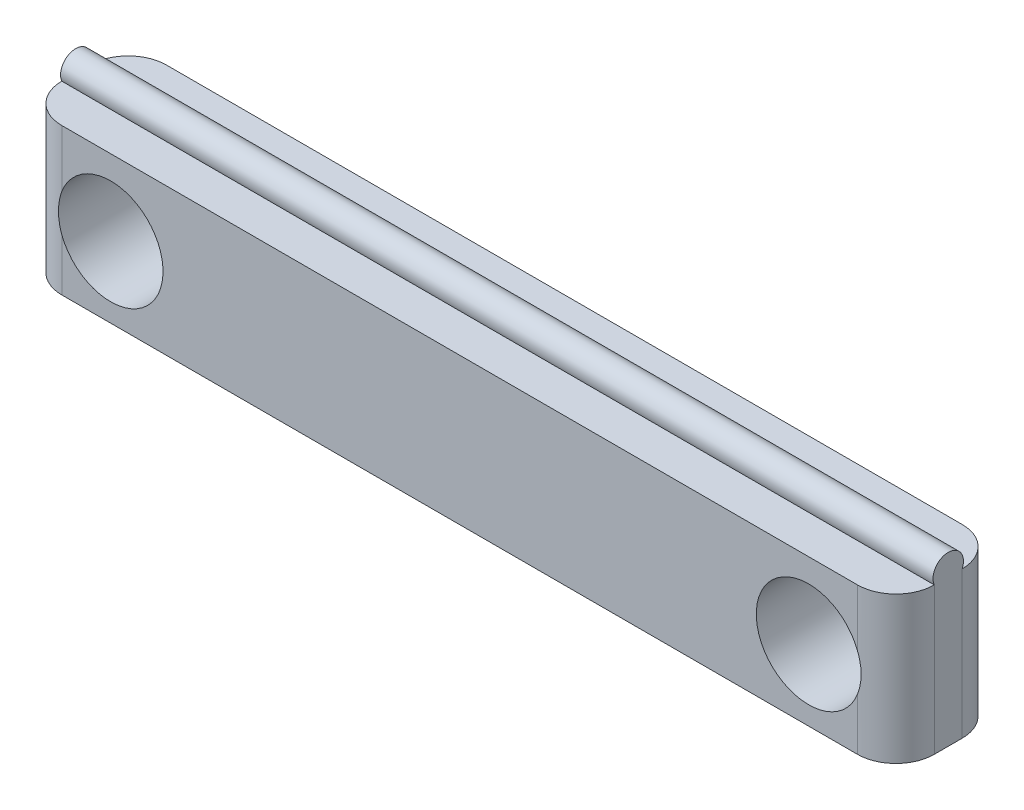
from build123d import *

# Parameters (mm, degrees)
SKETCH1_W           = 1250
SKETCH1_H           = 210.257392811
BOSS_EXTRUDE1_DEPTH = 150
SKETCH2_R           = 75
CUT_EXTRUDE1_DEPTH  = 150
FILLET3_R           = 55
BOSS_EXTRUDE2_DEPTH = 1250


with BuildPart() as part:
    # Sketch1 → Boss-Extrude1 (new body)
    with BuildSketch(Plane.XY):
        with Locations((500, 3.571821645)):
            Rectangle(SKETCH1_W, SKETCH1_H)
    extrude(amount=BOSS_EXTRUDE1_DEPTH)

    # Sketch2 → Cut-Extrude1 (cut)
    with BuildSketch(Plane.XY.offset(150)):
        Circle(SKETCH2_R)
        with Locations((1000, 0)):
            Circle(SKETCH2_R)
    extrude(amount=-CUT_EXTRUDE1_DEPTH, mode=Mode.SUBTRACT)

    # Fillet3
    # the kernel refuses this fillet: 55 mm, written as the material it takes off along each edge
    with BuildSketch(Plane(origin=(1125, 246.20051805, 150), x_dir=(0, 0, -1), z_dir=(0, -1, 0)), Plane(origin=(-125, -239.056874761, 150), x_dir=(0, 0, -1), z_dir=(0, 1, 0))) as fillet3_piece_1:
        with BuildLine():
            CenterArc((FILLET3_R, -FILLET3_R), FILLET3_R, 90, 90)
            Line((0, -FILLET3_R), (0, 0))
            Line((0, 0), (FILLET3_R, 0))
        make_face()
    extrude(amount=485.257392811, mode=Mode.SUBTRACT)
    with BuildSketch(Plane(origin=(1125, 246.20051805, 0), x_dir=(0, 0, 1), z_dir=(0, -1, 0)), Plane(origin=(-125, -239.056874761, 0), x_dir=(0, 0, 1), z_dir=(0, 1, 0))) as fillet3_piece_2:
        with BuildLine():
            CenterArc((FILLET3_R, FILLET3_R), FILLET3_R, 180, 90)
            Line((0, FILLET3_R), (0, 0))
            Line((0, 0), (FILLET3_R, 0))
        make_face()
    extrude(amount=485.257392811, mode=Mode.SUBTRACT)

    # Sketch3 → Boss-Extrude2 (add, through all)
    with BuildSketch(Plane.ZY.offset(125)):
        with BuildLine():
            Line((95, 108.70051805), (55, 108.70051805))
            ThreePointArc((55, 108.70051805), (75, 139.142597248), (95, 108.70051805))
        make_face()
    extrude(amount=-BOSS_EXTRUDE2_DEPTH)


solid = part.part
